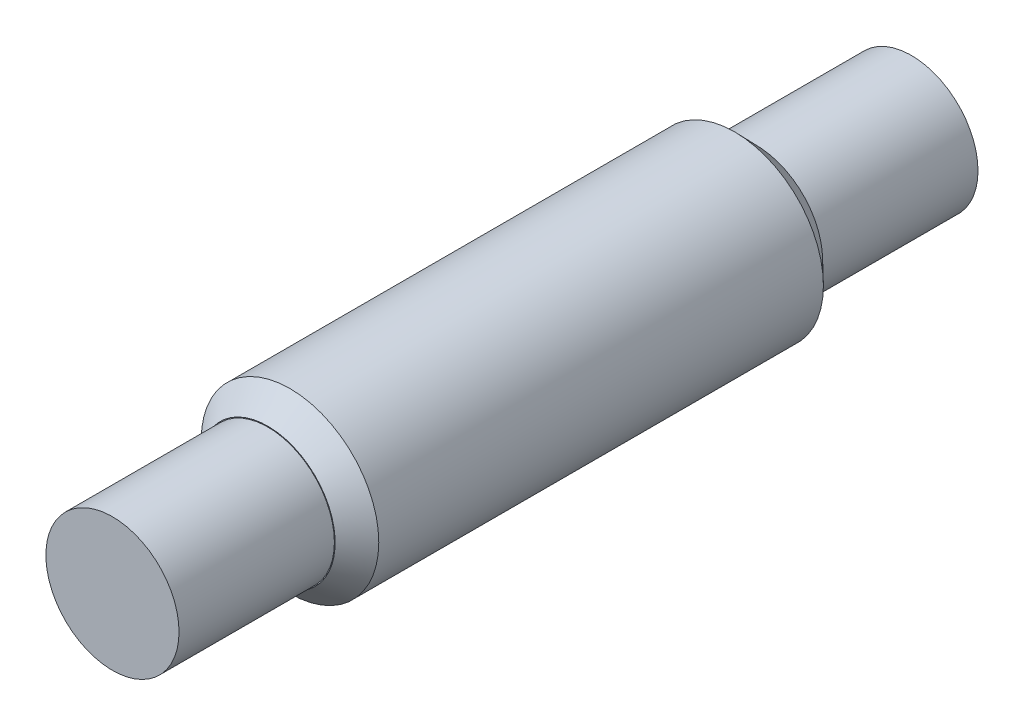
from build123d import *
from OCP.BRepFilletAPI import BRepFilletAPI_MakeChamfer

# Parameters (mm, degrees)
CHAMFER1_SIZE   = 0.5
CHAMFER1_SIZE_2 = 0.482844387


with BuildPart() as part:
    # Sketch1 → Revolve1 (revolve)
    with BuildSketch(Plane(origin=(0, 0, 0), x_dir=(0, 0, -1), z_dir=(1, 0, 0)), mode=Mode.PRIVATE) as revolve1_sk:
        Polygon((-9, 0), (9, 0), (9, 1.5), (5.5, 1.5), (5.5, 2), (-5.5, 2), (-5.5, 1.5), (-9, 1.5), align=None)
    revolve(revolve1_sk.sketch.rotate(Axis((0, 0, 9), (0, 0, -1)), 90), axis=Axis((0, 0, 9), (0, 0, -1)))

    # Chamfer1
    chamfer1_edges_1 = [part.edges().sort_by_distance(p)[0] for p in [
        (-2, 0, -5.5),
    ]]
    chamfer1_side_1 = [part.faces().sort_by_distance(p)[0] for p in [
        (-1.990343112, 0, -5.5),
    ]]
    chamfer1_edges_2 = [part.edges().sort_by_distance(p)[0] for p in [
        (-2, 0, 5.5),
    ]]
    chamfer1_side_2 = [part.faces().sort_by_distance(p)[0] for p in [
        (-2, 0, 5.490343112),
    ]]
    chamfer1 = BRepFilletAPI_MakeChamfer(part.part.solid().wrapped)
    for e in chamfer1_edges_1:
        chamfer1.Add(CHAMFER1_SIZE - 0.0001, CHAMFER1_SIZE_2 - 0.0001, e.wrapped, chamfer1_side_1[0].wrapped)
    for e in chamfer1_edges_2:
        chamfer1.Add(CHAMFER1_SIZE - 0.0001, CHAMFER1_SIZE_2 - 0.0001, e.wrapped, chamfer1_side_2[0].wrapped)
    add(Compound.cast(chamfer1.Shape()), mode=Mode.REPLACE)  # a hair under: the kernel refuses the full size


solid = part.part
